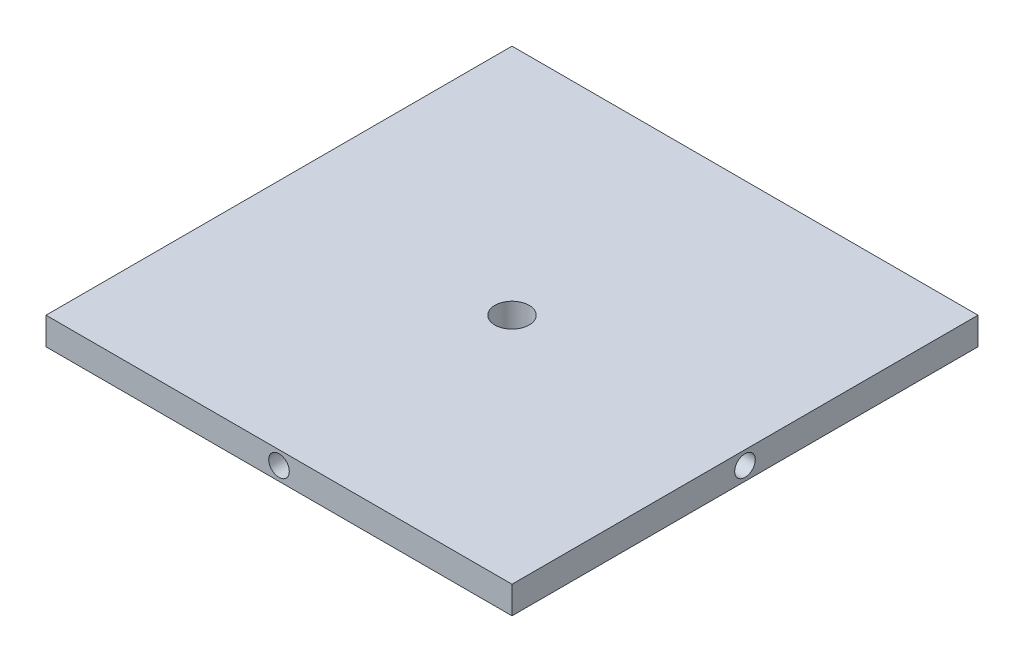
from build123d import *

# Parameters (mm, degrees)
SKETCH1_W                       = 431.8
SKETCH1_H                       = 431.8
SKETCH1_R                       = 15.875
BOSS_EXTRUDE1_DEPTH             = 25.4
F_3_4_0_75_DIAMETER_HOLE2_D     = 19.05
F_3_4_0_75_DIAMETER_HOLE2_DEPTH = 76.2
F_3_4_0_75_DIAMETER_HOLE2_TIP   = 5.723197396
F_3_4_0_75_DIAMETER_HOLE1_D     = 19.05
F_3_4_0_75_DIAMETER_HOLE1_DEPTH = 76.2
F_3_4_0_75_DIAMETER_HOLE1_TIP   = 5.723197396


with BuildPart() as part:
    # Sketch1 → Boss-Extrude1 (new body)
    with BuildSketch(Plane(origin=(0, 0, 0), x_dir=(1, 0, 0), z_dir=(0, 1, 0))):
        Rectangle(SKETCH1_W, SKETCH1_H)
        Circle(SKETCH1_R, mode=Mode.SUBTRACT)
    extrude(amount=BOSS_EXTRUDE1_DEPTH)

    # 3/4 (0.75) Diameter Hole2
    with Locations(Plane(origin=(215.9, 0, 0), x_dir=(0, 0, -1), z_dir=(1, 0, 0))):
        with Locations((0, 12.7)):
            Hole(F_3_4_0_75_DIAMETER_HOLE2_D / 2, depth=F_3_4_0_75_DIAMETER_HOLE2_DEPTH)
            with Locations((0, 0, -(F_3_4_0_75_DIAMETER_HOLE2_DEPTH + F_3_4_0_75_DIAMETER_HOLE2_TIP / 2))):  # 118° drill point
                Cone(0, F_3_4_0_75_DIAMETER_HOLE2_D / 2, F_3_4_0_75_DIAMETER_HOLE2_TIP, mode=Mode.SUBTRACT)

    # 3/4 (0.75) Diameter Hole1
    with Locations(Plane.XY.offset(215.9)):
        with Locations((0, 12.7)):
            Hole(F_3_4_0_75_DIAMETER_HOLE1_D / 2, depth=F_3_4_0_75_DIAMETER_HOLE1_DEPTH)
            with Locations((0, 0, -(F_3_4_0_75_DIAMETER_HOLE1_DEPTH + F_3_4_0_75_DIAMETER_HOLE1_TIP / 2))):  # 118° drill point
                Cone(0, F_3_4_0_75_DIAMETER_HOLE1_D / 2, F_3_4_0_75_DIAMETER_HOLE1_TIP, mode=Mode.SUBTRACT)


solid = part.part
